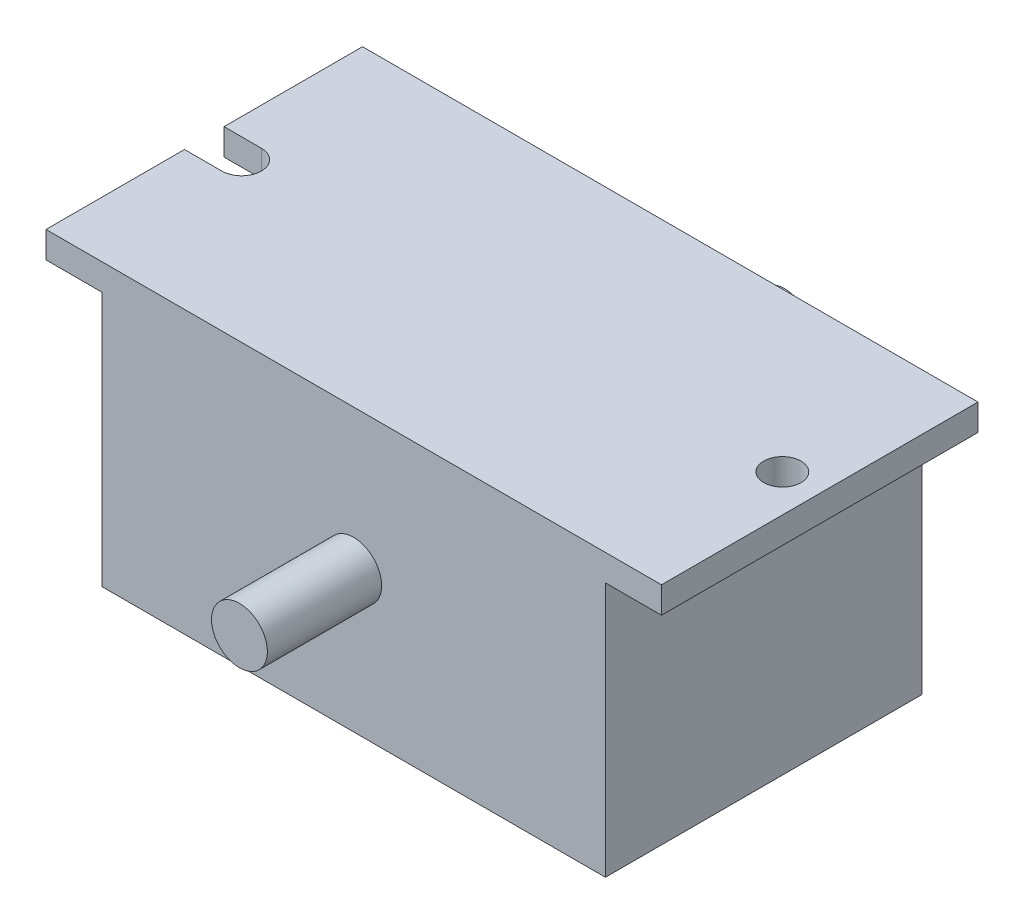
from build123d import *

# Parameters (mm, degrees)
BOSS_EXTRUDE1_DEPTH = 72
SKETCH2_R           = 4.25
CUT_EXTRUDE1_DEPTH  = 120.079805173
SKETCH3_R           = 6.35
BOSS_EXTRUDE2_DEPTH = 26
BOSS_EXTRUDE3_START = 26
SKETCH5_R           = 6.35
BOSS_EXTRUDE3_DEPTH = 26


with BuildPart() as part:
    # Sketch1 → Boss-Extrude1 (new body)
    with BuildSketch(Plane.XY):
        Polygon((-57.25, 32), (57.25, 32), (70, 32), (70, 26), (57.25, 26), (57.25, -32), (-57.25, -32), (-57.25, 26), (-70, 26), (-70, 32), align=None)
    extrude(amount=BOSS_EXTRUDE1_DEPTH)

    # Sketch2 → Cut-Extrude1 (cut, through all)
    with BuildSketch(Plane(origin=(0, 32, 0), x_dir=(1, 0, 0), z_dir=(0, 1, 0))):
        with Locations((61.5, -36)):
            Circle(SKETCH2_R)
        with BuildLine():
            Line((-61.5, -31.5), (-70, -31.5))
            Line((-70, -31.5), (-70, -40.5))
            Line((-70, -40.5), (-61.5, -40.5))
            ThreePointArc((-61.5, -40.5), (-57, -36), (-61.5, -31.5))
        make_face()
    extrude(amount=-CUT_EXTRUDE1_DEPTH, mode=Mode.SUBTRACT)

    # Sketch3 → Boss-Extrude2 (add)
    with BuildSketch(Plane.XY.offset(72)):
        Circle(SKETCH3_R)
    extrude(amount=BOSS_EXTRUDE2_DEPTH)

    # Sketch5 → Boss-Extrude3 (add)
    with BuildSketch(Plane(origin=(0, 0, 0), x_dir=(-1, 0, 0), z_dir=(0, 0, -1)).offset(BOSS_EXTRUDE3_START)):
        Circle(SKETCH5_R)
    extrude(amount=-BOSS_EXTRUDE3_DEPTH)


solid = part.part
